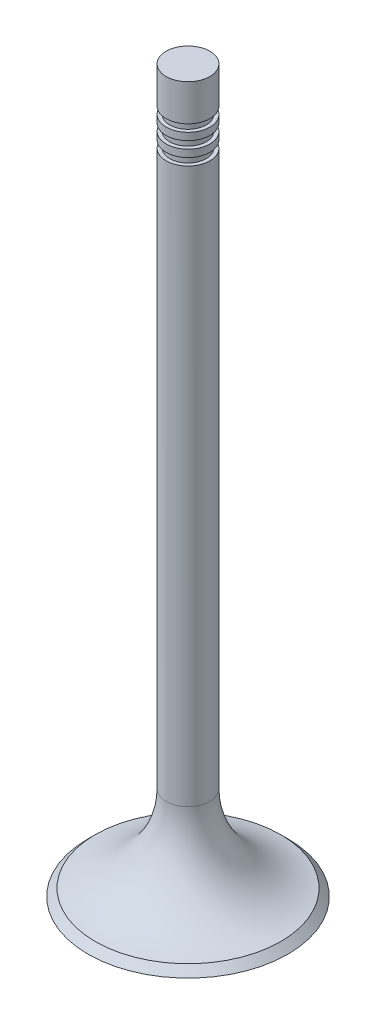
from build123d import *

# Parameters (mm, degrees)
SKETCH1_R           = 13.7
BOSS_EXTRUDE1_DEPTH = 1
CHAMFER2_SIZE       = 1
SKETCH4_R           = 3
BOSS_EXTRUDE2_DEPTH = 97.8
FILLET1_R           = 12
SKETCH5_W           = 0.49999999999999956
SKETCH5_H           = 1


# Some blends are built 0.0001 mm under size
with BuildPart() as part:
    # Sketch1 → Boss-Extrude1 (new body)
    with BuildSketch(Plane(origin=(0, 0, 0), x_dir=(1, 0, 0), z_dir=(0, 1, 0))):
        with Locations(Location((0, 0, 0), (0, 0, 270))):
            Circle(SKETCH1_R)
    extrude(amount=BOSS_EXTRUDE1_DEPTH)

    # Chamfer2
    chamfer2_edges = [part.edges().sort_by_distance(p)[0] for p in [
        (4.19e-15, 1, -13.7),
    ]]
    chamfer(chamfer2_edges, length=CHAMFER2_SIZE - 0.0001)  # a hair under: the kernel refuses the full size

    # Sketch4 → Boss-Extrude2 (add)
    with BuildSketch(Plane(origin=(0, 1, 0), x_dir=(1, 0, 0), z_dir=(0, 1, 0))):
        with Locations(Location((0, 0, 0), (0, 0, 270))):
            Circle(SKETCH4_R)
    extrude(amount=BOSS_EXTRUDE2_DEPTH)

    # Fillet1
    # the kernel refuses this fillet: 12 mm, written as the material it adds along each edge
    with BuildSketch(Plane(origin=(0, 1, 0), x_dir=(-1.8e-16, 0, 1), z_dir=(-1, 0, -1.8e-16))) as fillet1_piece_1:
        with BuildLine():
            CenterArc((15, 11.777540489856218), FILLET1_R, 180, 78.95042152448133)
            Line((3, 11.777540489856218), (2.76, 11.777540489856218))
            Line((2.76, 11.777540489856218), (2.76, 0))
            Line((2.76, 0), (3, -0.24))
            ThreePointArc((3, -0.24), (7.850050000000809, -0.24), (12.65410200000165, -0.23555080978867193))
            Line((12.65410200000165, -0.23555080978867193), (12.700100000001617, 8.2867e-12))
        make_face()
    revolve(axis=Axis((0, 1, 0), (0, 1, 0)))

    # Sketch5 → Cut-Revolve1 (revolve, cut)
    with BuildSketch(Plane.XY, mode=Mode.PRIVATE) as cut_revolve1_sk:
        with Locations((-2.75, 93.30000000000001)):
            Rectangle(SKETCH5_W, SKETCH5_H)
        with Locations((-2.75, 91.3)):
            Rectangle(SKETCH5_W, SKETCH5_H)
        Polygon((-2.500000000000001, 89.8), (-2.5000000000000004, 88.79999999999998), (-3.0000000000000004, 88.79999999999998), (-3.0000000000000004, 89.8), align=None)
    revolve(cut_revolve1_sk.sketch.rotate(Axis((0, 98.8, 0), (0, -1, 0)), 270), axis=Axis((0, 98.8, 0), (0, -1, 0)), mode=Mode.SUBTRACT)


solid = part.part
